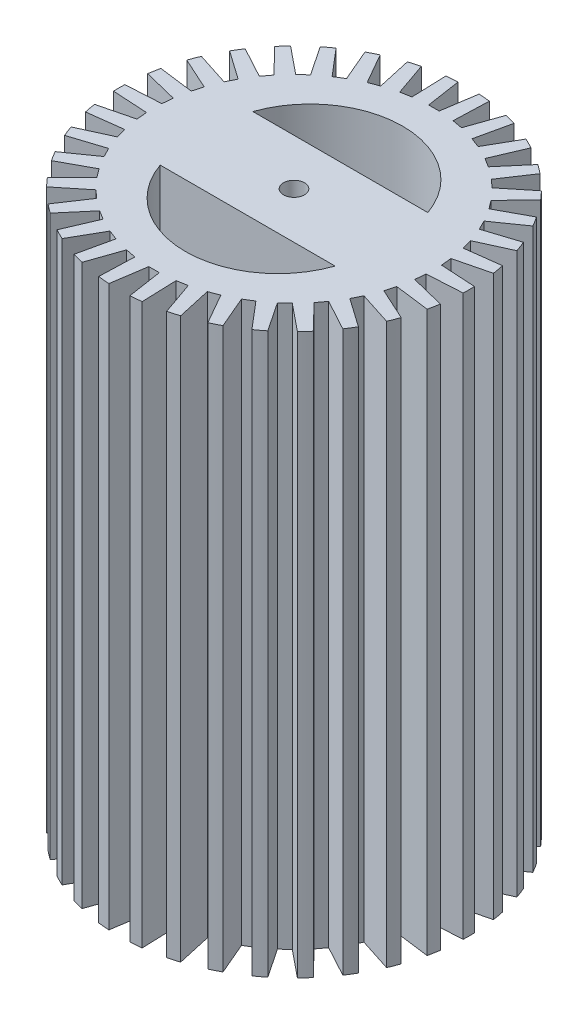
from build123d import *

# Parameters (mm, degrees)
BOSS_EXTRUDE2_DEPTH = 80
CUT_EXTRUDE3_DEPTH  = 88.451415083
SKETCH6_RX          = 8
SKETCH6_RY          = 4
CUT_EXTRUDE4_DEPTH  = 75
SKETCH7_R           = 1.5
CUT_EXTRUDE5_DEPTH  = 83.902050638


# Read off the part's stored shape, not the designer's step: Boss-Extrude2
with BuildPart() as part:
    # Boss-Extrude2 outline → Boss-Extrude2 (new body)
    with BuildSketch(Plane(origin=(0, 0, 0), x_dir=(1, 0, 0), z_dir=(0, 1, 0))):
        with BuildLine():
            Line((1.5, 24.954959427), (0.75, 20))
            Line((0.75, 20), (-0.75, 20))
            Line((-0.75, 20), (-1.5, 24.954959427))
            ThreePointArc((-1.5, 24.954959427), (-2.306708986, 24.893354407), (-3.111002112, 24.805678097))
            Line((-3.111002112, 24.805678097), (-2.937760532, 19.797274132))
            Line((-2.937760532, 19.797274132), (-4.412220181, 19.521649855))
            Line((-4.412220181, 19.521649855), (-6.059921411, 24.254429544))
            ThreePointArc((-6.059921411, 24.254429544), (-6.841574752, 24.045641079), (-7.616062779, 23.811669151))
            Line((-7.616062779, 23.811669151), (-6.525479152, 18.920375838))
            Line((-6.525479152, 18.920375838), (-7.924187496, 18.378513338))
            Line((-7.924187496, 18.378513338), (-10.413479467, 22.727944152))
            ThreePointArc((-10.413479467, 22.727944152), (-11.143458894, 22.379082284), (-11.861767562, 22.006782371))
            Line((-11.861767562, 22.006782371), (-9.890980406, 17.399166837))
            Line((-9.890980406, 17.399166837), (-11.166306109, 16.609518592))
            Line((-11.166306109, 16.609518592), (-14.412418969, 20.427485882))
            ThreePointArc((-14.412418969, 20.427485882), (-15.065865909, 19.950430682), (-15.703534077, 19.452481011))
            Line((-15.703534077, 19.452481011), (-12.919656185, 15.285450077))
            Line((-12.919656185, 15.285450077), (-14.028169561, 14.274906612))
            Line((-14.028169561, 14.274906612), (-17.920560829, 17.43139408))
            ThreePointArc((-17.920560829, 17.43139408), (-18.475222931, 16.842391091), (-19.010535574, 16.235748741))
            Line((-19.010535574, 16.235748741), (-15.508368568, 12.651205648))
            Line((-15.508368568, 12.651205648), (-16.412320523, 11.454179807))
            Line((-16.412320523, 11.454179807), (-20.818439483, 13.841697059))
            ThreePointArc((-20.818439483, 13.841697059), (-21.255428393, 13.160804072), (-21.670156083, 12.46612752))
            Line((-21.670156083, 12.46612752), (-17.56896206, 9.586139584))
            Line((-17.56896206, 9.586139584), (-18.237569594, 8.243394647))
            Line((-18.237569594, 8.243394647), (-23.00737115, 9.780637646))
            ThreePointArc((-23.00737115, 9.780637646), (-23.311805735, 9.031041655), (-23.591825416, 8.271987279))
            Line((-23.591825416, 8.271987279), (-19.031265621, 6.194629034))
            Line((-19.031265621, 6.194629034), (-19.441760106, 4.751890569))
            Line((-19.441760106, 4.751890569), (-24.412814386, 5.386510349))
            ThreePointArc((-24.412814386, 5.386510349), (-24.574327492, 4.593737945), (-24.71010343, 3.796154431))
            Line((-24.71010343, 3.796154431), (-19.845482256, 2.592167821))
            Line((-19.845482256, 2.592167821), (-19.983884795, 1.098566557))
            Line((-19.983884795, 1.098566557), (-24.986908509, 0.808951902))
            ThreePointArc((-24.986908509, 0.808951902), (-25, 0), (-24.986908509, -0.808951902))
            Line((-24.986908509, -0.808951902), (-19.983884795, -1.098566557))
            Line((-19.983884795, -1.098566557), (-19.845482256, -2.592167821))
            Line((-19.845482256, -2.592167821), (-24.71010343, -3.796154431))
            ThreePointArc((-24.71010343, -3.796154431), (-24.574327492, -4.593737945), (-24.412814386, -5.386510349))
            Line((-24.412814386, -5.386510349), (-19.441760106, -4.751890569))
            Line((-19.441760106, -4.751890569), (-19.031265621, -6.194629034))
            Line((-19.031265621, -6.194629034), (-23.591825416, -8.271987279))
            ThreePointArc((-23.591825416, -8.271987279), (-23.311805735, -9.031041655), (-23.00737115, -9.780637646))
            Line((-23.00737115, -9.780637646), (-18.237569594, -8.243394647))
            Line((-18.237569594, -8.243394647), (-17.56896206, -9.586139584))
            Line((-17.56896206, -9.586139584), (-21.670156083, -12.46612752))
            ThreePointArc((-21.670156083, -12.46612752), (-21.255428393, -13.160804072), (-20.818439483, -13.841697059))
            Line((-20.818439483, -13.841697059), (-16.412320523, -11.454179807))
            Line((-16.412320523, -11.454179807), (-15.508368568, -12.651205648))
            Line((-15.508368568, -12.651205648), (-19.010535574, -16.235748741))
            ThreePointArc((-19.010535574, -16.235748741), (-18.475222931, -16.842391091), (-17.920560829, -17.43139408))
            Line((-17.920560829, -17.43139408), (-14.028169561, -14.274906612))
            Line((-14.028169561, -14.274906612), (-12.919656185, -15.285450077))
            Line((-12.919656185, -15.285450077), (-15.703534077, -19.452481011))
            ThreePointArc((-15.703534077, -19.452481011), (-15.065865909, -19.950430682), (-14.412418969, -20.427485882))
            Line((-14.412418969, -20.427485882), (-11.166306109, -16.609518592))
            Line((-11.166306109, -16.609518592), (-9.890980406, -17.399166837))
            Line((-9.890980406, -17.399166837), (-11.861767562, -22.006782371))
            ThreePointArc((-11.861767562, -22.006782371), (-11.143458894, -22.379082284), (-10.413479467, -22.727944152))
            Line((-10.413479467, -22.727944152), (-7.924187496, -18.378513338))
            Line((-7.924187496, -18.378513338), (-6.525479152, -18.920375838))
            Line((-6.525479152, -18.920375838), (-7.616062779, -23.811669151))
            ThreePointArc((-7.616062779, -23.811669151), (-6.841574752, -24.045641079), (-6.059921411, -24.254429544))
            Line((-6.059921411, -24.254429544), (-4.412220181, -19.521649855))
            Line((-4.412220181, -19.521649855), (-2.937760532, -19.797274132))
            Line((-2.937760532, -19.797274132), (-3.111002112, -24.805678097))
            ThreePointArc((-3.111002112, -24.805678097), (-2.306708986, -24.893354407), (-1.5, -24.954959427))
            Line((-1.5, -24.954959427), (-0.75, -20))
            Line((-0.75, -20), (0.75, -20))
            Line((0.75, -20), (1.5, -24.954959427))
            ThreePointArc((1.5, -24.954959427), (2.306708986, -24.893354407), (3.111002112, -24.805678097))
            Line((3.111002112, -24.805678097), (2.937760532, -19.797274132))
            Line((2.937760532, -19.797274132), (4.412220181, -19.521649855))
            Line((4.412220181, -19.521649855), (6.059921411, -24.254429544))
            ThreePointArc((6.059921411, -24.254429544), (6.841574752, -24.045641079), (7.616062779, -23.811669151))
            Line((7.616062779, -23.811669151), (6.525479152, -18.920375838))
            Line((6.525479152, -18.920375838), (7.924187496, -18.378513338))
            Line((7.924187496, -18.378513338), (10.413479467, -22.727944152))
            ThreePointArc((10.413479467, -22.727944152), (11.143458894, -22.379082284), (11.861767562, -22.006782371))
            Line((11.861767562, -22.006782371), (9.890980406, -17.399166837))
            Line((9.890980406, -17.399166837), (11.166306109, -16.609518592))
            Line((11.166306109, -16.609518592), (14.412418969, -20.427485882))
            ThreePointArc((14.412418969, -20.427485882), (15.065865909, -19.950430682), (15.703534077, -19.452481011))
            Line((15.703534077, -19.452481011), (12.919656185, -15.285450077))
            Line((12.919656185, -15.285450077), (14.028169561, -14.274906612))
            Line((14.028169561, -14.274906612), (17.920560829, -17.43139408))
            ThreePointArc((17.920560829, -17.43139408), (18.475222931, -16.842391091), (19.010535574, -16.235748741))
            Line((19.010535574, -16.235748741), (15.508368568, -12.651205648))
            Line((15.508368568, -12.651205648), (16.412320523, -11.454179807))
            Line((16.412320523, -11.454179807), (20.818439483, -13.841697059))
            ThreePointArc((20.818439483, -13.841697059), (21.255428393, -13.160804072), (21.670156083, -12.46612752))
            Line((21.670156083, -12.46612752), (17.56896206, -9.586139584))
            Line((17.56896206, -9.586139584), (18.237569594, -8.243394647))
            Line((18.237569594, -8.243394647), (23.00737115, -9.780637646))
            ThreePointArc((23.00737115, -9.780637646), (23.311805735, -9.031041655), (23.591825416, -8.271987279))
            Line((23.591825416, -8.271987279), (19.031265621, -6.194629034))
            Line((19.031265621, -6.194629034), (19.441760106, -4.751890569))
            Line((19.441760106, -4.751890569), (24.412814386, -5.386510349))
            ThreePointArc((24.412814386, -5.386510349), (24.574327492, -4.593737945), (24.71010343, -3.796154431))
            Line((24.71010343, -3.796154431), (19.845482256, -2.592167821))
            Line((19.845482256, -2.592167821), (19.983884796, -1.098566557))
            Line((19.983884796, -1.098566557), (24.986908509, -0.808951902))
            ThreePointArc((24.986908509, -0.808951902), (25, 0), (24.986908509, 0.808951902))
            Line((24.986908509, 0.808951902), (19.983884796, 1.098566557))
            Line((19.983884796, 1.098566557), (19.845482256, 2.592167821))
            Line((19.845482256, 2.592167821), (24.71010343, 3.796154431))
            ThreePointArc((24.71010343, 3.796154431), (24.574327492, 4.593737945), (24.412814386, 5.386510349))
            Line((24.412814386, 5.386510349), (19.441760106, 4.751890569))
            Line((19.441760106, 4.751890569), (19.031265621, 6.194629034))
            Line((19.031265621, 6.194629034), (23.591825416, 8.271987279))
            ThreePointArc((23.591825416, 8.271987279), (23.311805735, 9.031041655), (23.00737115, 9.780637646))
            Line((23.00737115, 9.780637646), (18.237569594, 8.243394647))
            Line((18.237569594, 8.243394647), (17.56896206, 9.586139584))
            Line((17.56896206, 9.586139584), (21.670156083, 12.46612752))
            ThreePointArc((21.670156083, 12.46612752), (21.255428393, 13.160804072), (20.818439483, 13.841697059))
            Line((20.818439483, 13.841697059), (16.412320523, 11.454179807))
            Line((16.412320523, 11.454179807), (15.508368568, 12.651205648))
            Line((15.508368568, 12.651205648), (19.010535574, 16.235748741))
            ThreePointArc((19.010535574, 16.235748741), (18.475222931, 16.842391091), (17.920560829, 17.43139408))
            Line((17.920560829, 17.43139408), (14.028169561, 14.274906612))
            Line((14.028169561, 14.274906612), (12.919656185, 15.285450077))
            Line((12.919656185, 15.285450077), (15.703534077, 19.452481011))
            ThreePointArc((15.703534077, 19.452481011), (15.065865909, 19.950430682), (14.412418969, 20.427485882))
            Line((14.412418969, 20.427485882), (11.166306109, 16.609518592))
            Line((11.166306109, 16.609518592), (9.890980406, 17.399166837))
            Line((9.890980406, 17.399166837), (11.861767562, 22.006782371))
            ThreePointArc((11.861767562, 22.006782371), (11.143458894, 22.379082284), (10.413479467, 22.727944152))
            Line((10.413479467, 22.727944152), (7.924187496, 18.378513338))
            Line((7.924187496, 18.378513338), (6.525479152, 18.920375838))
            Line((6.525479152, 18.920375838), (7.616062779, 23.811669151))
            ThreePointArc((7.616062779, 23.811669151), (6.841574752, 24.045641079), (6.059921411, 24.254429544))
            Line((6.059921411, 24.254429544), (4.412220181, 19.521649855))
            Line((4.412220181, 19.521649855), (2.937760532, 19.797274132))
            Line((2.937760532, 19.797274132), (3.111002112, 24.805678097))
            ThreePointArc((3.111002112, 24.805678097), (2.306708986, 24.893354407), (1.5, 24.954959427))
        make_face()
    extrude(amount=BOSS_EXTRUDE2_DEPTH)

    # Sketch5 → Cut-Extrude3 (cut, through all)
    with BuildSketch(Plane.XZ):
        with BuildLine():
            Line((-12.5, 6.623664739), (12.5, 6.623664739))
            ThreePointArc((12.5, 6.623664739), (0, 15.524722913), (-12.5, 6.623664739))
        make_face()
        with BuildLine():
            Line((12.5, -6.623664739), (-12.5, -6.623664739))
            ThreePointArc((-12.5, -6.623664739), (0, -15.524722913), (12.5, -6.623664739))
        make_face()
    extrude(amount=-CUT_EXTRUDE3_DEPTH, mode=Mode.SUBTRACT)

    # Sketch6 → Cut-Extrude4 (cut)
    with BuildSketch(Plane(origin=(0, 0, 0), x_dir=(-1, 0, 0), z_dir=(0, -1, 0))):
        with Locations((0, 0)):
            Ellipse(SKETCH6_RX, SKETCH6_RY)
    extrude(amount=-CUT_EXTRUDE4_DEPTH, mode=Mode.SUBTRACT)

    # Sketch7 → Cut-Extrude5 (cut, through all)
    with BuildSketch(Plane.XZ.offset(-75)):
        with Locations(Location((0, 0, 0), (0, 0, 270))):
            Circle(SKETCH7_R)
    extrude(amount=-CUT_EXTRUDE5_DEPTH, mode=Mode.SUBTRACT)


solid = part.part
